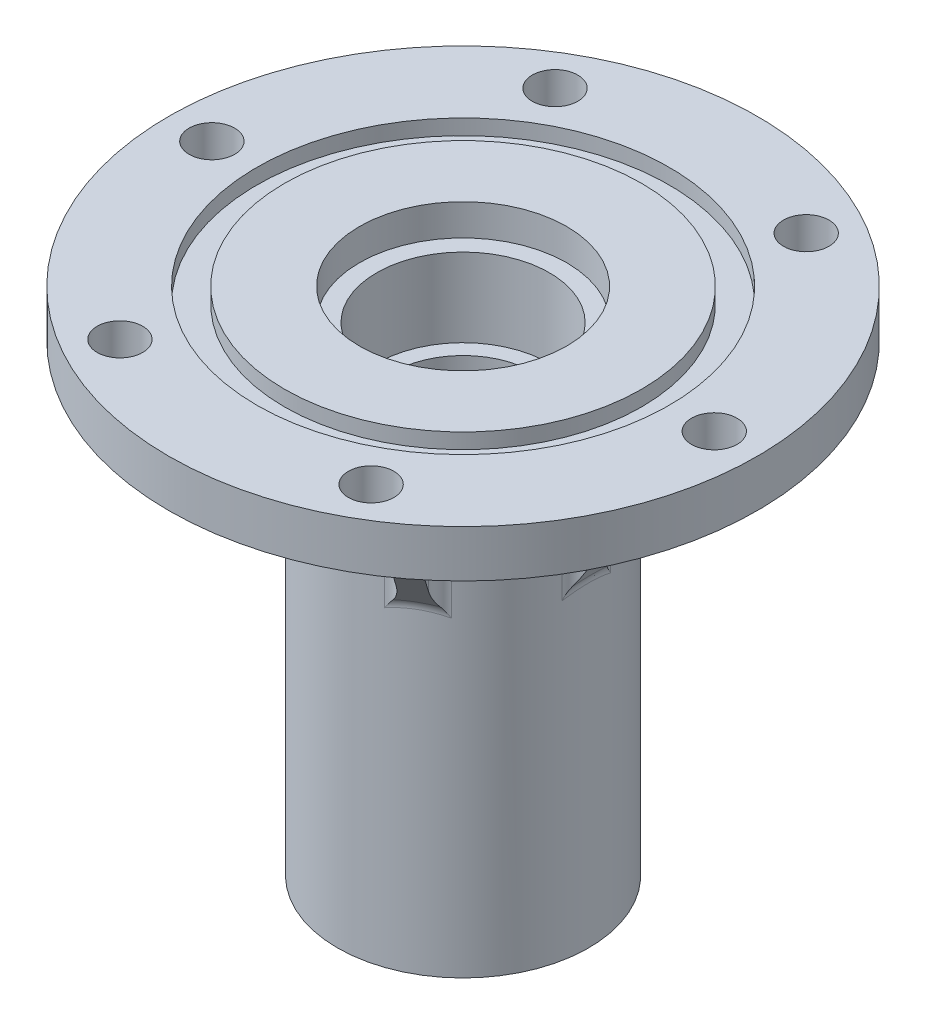
from build123d import *

# Parameters (mm, degrees)
M5_CLEARANCE_HOLE1_D = 5.8
BOSS_EXTRUDE1_DEPTH  = 1.5
CIRPATTERN1_COUNT    = 6
FILLET2_R            = 2
SKETCH9_R            = 5.5
CUT_EXTRUDE1_DEPTH   = 80.331582688


with BuildPart() as part:
    # Sketch1 → Revolve1 (revolve)
    with BuildSketch(Plane.XY, mode=Mode.PRIVATE) as revolve1_sk:
        Polygon((37.5, 0), (26.2636, 0), (26.2636, -1.9558), (22.733, -1.9558), (22.733, 0), (13.2, 0), (13.2, -4), (11, -4), (11, -14), (9, -14), (9, -17), (11, -17), (11, -30.5), (12.5, -30.5), (12.5, -65), (16, -65), (16, -6), (37.5, -6), align=None)
    revolve(revolve1_sk.sketch.rotate(Axis((0, 0, 0), (0, -1, 0)), 90), axis=Axis((0, 0, 0), (0, -1, 0)))

    # M5 Clearance Hole1 (through all)
    with Locations(Plane(origin=(0, 0, 0), x_dir=(1, 0, 0), z_dir=(0, 1, 0))):
        with Locations((16, 27.712812921), (32, 0), (16, -27.712812921), (-16, -27.712812921), (-32, 0), (-16, 27.712812921)):
            Hole(M5_CLEARANCE_HOLE1_D / 2)


with BuildPart() as body_2:
    # Sketch8 → Boss-Extrude1 (new, symmetric)
    with BuildSketch(Plane.XY):
        Polygon((26.5, -6), (12.785830206, -6), (12.785830206, -29.753638867), align=None)
    extrude(amount=BOSS_EXTRUDE1_DEPTH, both=True)


with BuildPart() as cirpattern1_1:
    # CirPattern1: pattern copy
    add(body_2.part.rotate(Axis((0, 0, 0), (0, 1, 0)), 1 * 360 / CIRPATTERN1_COUNT))


with BuildPart() as cirpattern1_2:
    # CirPattern1: pattern copy
    add(body_2.part.rotate(Axis((0, 0, 0), (0, 1, 0)), 2 * 360 / CIRPATTERN1_COUNT))


with BuildPart() as cirpattern1_3:
    # CirPattern1: pattern copy
    add(body_2.part.rotate(Axis((0, 0, 0), (0, 1, 0)), 3 * 360 / CIRPATTERN1_COUNT))


with BuildPart() as cirpattern1_4:
    # CirPattern1: pattern copy
    add(body_2.part.rotate(Axis((0, 0, 0), (0, 1, 0)), 4 * 360 / CIRPATTERN1_COUNT))


with BuildPart() as cirpattern1_5:
    # CirPattern1: pattern copy
    add(body_2.part.rotate(Axis((0, 0, 0), (0, 1, 0)), 5 * 360 / CIRPATTERN1_COUNT))


with BuildPart() as part_1:
    add(part.part)

    # Intersect1: read off the stored shape, not the designer's step
    # Intersect1: union CirPattern1_1, CirPattern1_2, CirPattern1_3, CirPattern1_4, CirPattern1_5, body 2
    add(cirpattern1_1.part)
    add(cirpattern1_2.part)
    add(cirpattern1_3.part)
    add(cirpattern1_4.part)
    add(cirpattern1_5.part)
    add(body_2.part)

    # Fillet2
    fillet2_edges = [part_1.edges().sort_by_distance(p)[0] for p in [
        (9.308344975, -6, -19.122526431),
        (0, -6, -16),
        (-13.25, -6, -22.9496732),
        (-11.906421186, -6, -17.622526431),
        (-13.856406461, -6, -8),
        (-26.5, -6, 0),
        (-21.214766161, -6, 1.5),
        (-13.856406461, -6, 8),
        (-13.25, -6, 22.9496732),
        (-9.308344975, -6, 19.122526431),
        (-3.41129927, -6, 15.632115573),
        (13.856406461, -6, 8),
        (26.5, -6, 0),
        (21.214766161, -6, -1.5),
        (13.856406461, -6, -8),
        (13.25, -6, -22.9496732),
        (16, -24.186533479, 0),
        (15.929532322, -15.154293539, -1.5),
        (21.214766161, -6, 1.5),
        (15.929532322, -15.154293539, 1.5),
        (6.665728055, -15.154293539, 14.545379661),
        (-9.263804267, -15.154293539, 13.045379661),
        (-15.929532322, -15.154293539, -1.5),
        (-6.665728055, -15.154293539, -14.545379661),
        (9.263804267, -15.154293539, -13.045379661),
        (8, -24.186533479, -13.856406461),
        (6.665728055, -15.154293539, -14.545379661),
        (11.906421186, -6, -17.622526431),
        (-8, -24.186533479, -13.856406461),
        (-9.263804267, -15.154293539, -13.045379661),
        (-9.308344975, -6, -19.122526431),
        (-16, -24.186533479, 0),
        (-15.929532322, -15.154293539, 1.5),
        (-21.214766161, -6, -1.5),
        (-8, -24.186533479, 13.856406461),
        (-6.665728055, -15.154293539, 14.545379661),
        (-11.906421186, -6, 17.622526431),
        (11.906421186, -6, 17.622526431),
        (13.25, -6, 22.9496732),
        (8, -24.186533479, 13.856406461),
        (9.263804267, -15.154293539, 13.045379661),
        (9.308344975, -6, 19.122526431),
    ]]
    fillet(fillet2_edges, radius=FILLET2_R)

    # Sketch9 → Cut-Extrude1 (cut, through all)
    with BuildSketch(Plane.XZ.offset(6)):
        with Locations((16, 27.712812921)):
            Circle(SKETCH9_R)
        with Locations((-16, 27.712812921)):
            Circle(SKETCH9_R)
        with Locations((-32, 0)):
            Circle(SKETCH9_R)
        with Locations((-16, -27.712812921)):
            Circle(SKETCH9_R)
        with Locations((16, -27.712812921)):
            Circle(SKETCH9_R)
        with Locations((32, 0)):
            Circle(SKETCH9_R)
    extrude(amount=CUT_EXTRUDE1_DEPTH, mode=Mode.SUBTRACT)


solid = part_1.part
